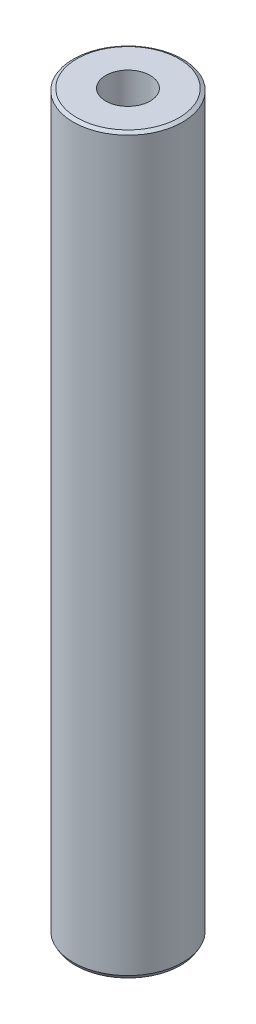
from build123d import *
from OCP.BRepFilletAPI import BRepFilletAPI_MakeChamfer

# Parameters (mm, degrees)
SKETCH1_R           = 32.5
BOSS_EXTRUDE1_DEPTH = 436.254081007
SKETCH2_R           = 13.235241016
CUT_EXTRUDE1_DEPTH  = 439.668580132
CHAMFER1_SIZE       = 1.217039454
CHAMFER1_SIZE2      = 2.107974169


with BuildPart() as part:
    # Sketch1 → Boss-Extrude1 (new body)
    with BuildSketch(Plane(origin=(0, 0, 0), x_dir=(1, 0, 0), z_dir=(0, 1, 0))):
        Circle(SKETCH1_R)
    extrude(amount=BOSS_EXTRUDE1_DEPTH)

    # Sketch2 → Cut-Extrude1 (cut, through all)
    with BuildSketch(Plane(origin=(0, 0, 0), x_dir=(1, 0, 0), z_dir=(0, 1, 0))):
        Circle(SKETCH2_R)
    extrude(amount=CUT_EXTRUDE1_DEPTH, mode=Mode.SUBTRACT)

    # Chamfer1: one chamfer whose edges measure the first distance from different faces: ONE call of the kernel's chamfer builder (chamfer() names one face for all edges)
    chamfer1_edges_1 = [part.edges().sort_by_distance(p)[0] for p in [
        (-32.5, 436.254081007, 0),
    ]]
    chamfer1_side_1 = [part.faces().sort_by_distance(p)[0] for p in [
        (-32.5, 218.127040504, 0),
    ]]
    chamfer1_edges_2 = [part.edges().sort_by_distance(p)[0] for p in [
        (-32.5, 0, 0),
    ]]
    chamfer1_side_2 = [part.faces().sort_by_distance(p)[0] for p in [
        (-31.580761184, 0, 0),
    ]]
    chamfer1 = BRepFilletAPI_MakeChamfer(part.part.solid().wrapped)
    for e in chamfer1_edges_1:
        chamfer1.Add(CHAMFER1_SIZE, CHAMFER1_SIZE2, e.wrapped, chamfer1_side_1[0].wrapped)  # the first distance lies on this face
    for e in chamfer1_edges_2:
        chamfer1.Add(CHAMFER1_SIZE, CHAMFER1_SIZE2, e.wrapped, chamfer1_side_2[0].wrapped)  # the first distance lies on this face
    add(Compound.cast(chamfer1.Shape()), mode=Mode.REPLACE)


solid = part.part
